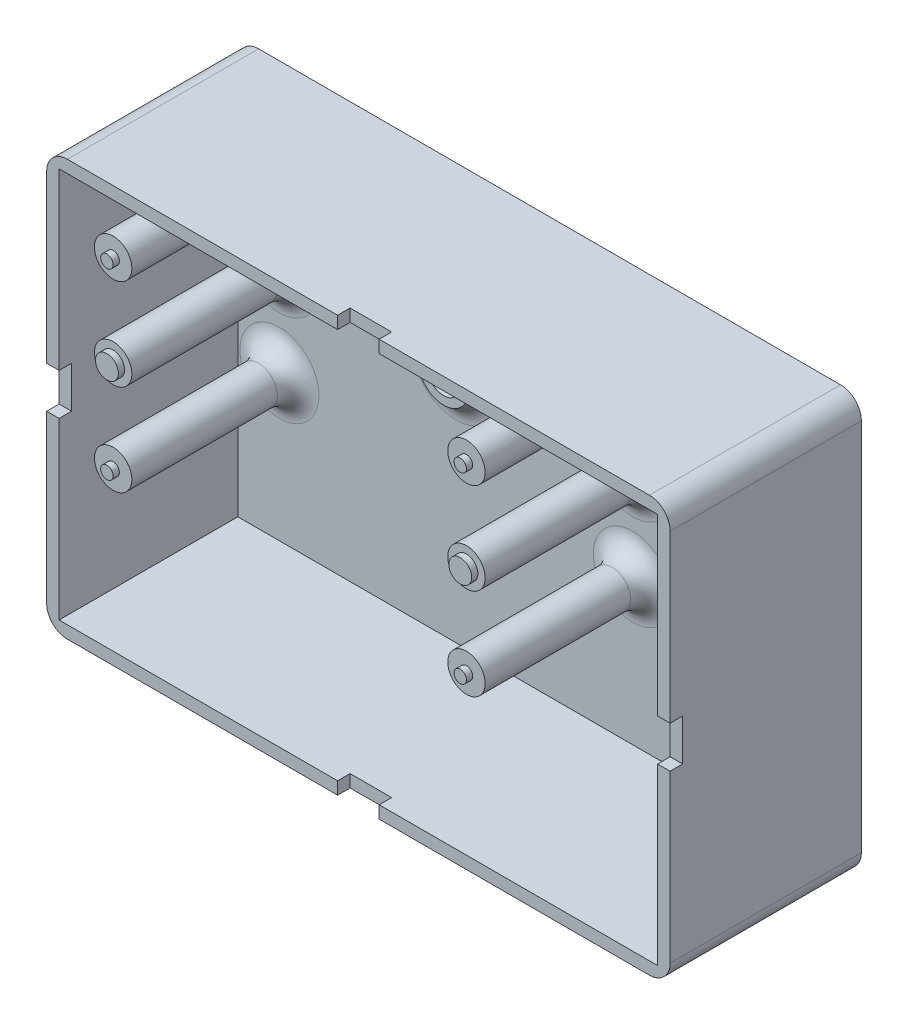
from build123d import *

# Parameters (mm, degrees)
SKETCH_1_W          = 150
SKETCH_1_H          = 100
EXTRUDE_1_DEPTH     = 46
SKETCH_3_W          = 144
SKETCH_3_H          = 94
CUT_EXTRUDE_2_DEPTH = 43
SKETCH_5_R          = 4.5
EXTRUDE_3_DEPTH     = 40
SKETCH_6_R          = 6
SKETCH_6_R_2        = 4
EXTRUDE_4_DEPTH     = 3
SKETCH_7_R          = 1.5
SKETCH_7_R_2        = 2.75
EXTRUDE_5_DEPTH     = 1.5
SKETCH_9_W          = 10
SKETCH_9_H          = 6
SKETCH_9_W_2        = 6
SKETCH_9_H_2        = 10
CUT_EXTRUDE_3_DEPTH = 3
FILLET_1_R          = 5


with BuildPart() as part:
    # 草图1 → 凸台-拉伸1 (new body)
    with BuildSketch(Plane.XY):
        Rectangle(SKETCH_1_W, SKETCH_1_H)
    extrude(amount=EXTRUDE_1_DEPTH)

    # 草图3 → 切除-拉伸2 (cut)
    with BuildSketch(Plane.XY.offset(46)):
        Rectangle(SKETCH_3_W, SKETCH_3_H)
    extrude(amount=-CUT_EXTRUDE_2_DEPTH, mode=Mode.SUBTRACT)

    # 草图5 → 凸台-拉伸3 (add)
    with BuildSketch(Plane.XY.offset(3)):
        with Locations((-62, 32)):
            Circle(SKETCH_5_R)
        with Locations((23, 32)):
            Circle(SKETCH_5_R)
        with Locations((-62, -12)):
            Circle(SKETCH_5_R)
        with Locations((23, -12)):
            Circle(SKETCH_5_R)
        with Locations((23, 10)):
            Circle(SKETCH_5_R)
        with Locations((-62, 10)):
            Circle(SKETCH_5_R)
    extrude(amount=EXTRUDE_3_DEPTH)

    # 草图6 → 凸台-拉伸4 (add)
    with BuildSketch(Plane.XY.offset(3)):
        with Locations((-19.5, 10)):
            Circle(SKETCH_6_R)
        with Locations((-19.5, 10)):
            Circle(SKETCH_6_R_2, mode=Mode.SUBTRACT)
    extrude(amount=EXTRUDE_4_DEPTH)

    # 草图7 → 凸台-拉伸5 (add)
    with BuildSketch(Plane.XY.offset(43)):
        with Locations((-62, 32)):
            Circle(SKETCH_7_R)
        with Locations((23, 32)):
            Circle(SKETCH_7_R)
        with Locations((-62, 10)):
            Circle(SKETCH_7_R_2)
        with Locations((23, 10)):
            Circle(SKETCH_7_R_2)
        with Locations((23, -12)):
            Circle(SKETCH_7_R)
        with Locations((-62, -12)):
            Circle(SKETCH_7_R)
    extrude(amount=EXTRUDE_5_DEPTH)

    # 草图9 → 切除-拉伸3 (cut)
    with BuildSketch(Plane.XY.offset(46)):
        with Locations((0, 47)):
            Rectangle(SKETCH_9_W, SKETCH_9_H)
        with Locations((0, -50)):
            Rectangle(SKETCH_9_W, SKETCH_9_H)
        with Locations((72, 0)):
            Rectangle(SKETCH_9_W_2, SKETCH_9_H_2)
        with Locations((-72, 0)):
            Rectangle(SKETCH_9_W_2, SKETCH_9_H_2)
    extrude(amount=-CUT_EXTRUDE_3_DEPTH, mode=Mode.SUBTRACT)

    # 圆角1
    # the kernel refuses this fillet: 5 mm, written as the material it adds along each edge
    with BuildSketch(Plane(origin=(-62, 32, 3), x_dir=(1, 0, 0), z_dir=(0, -1, 0))) as fillet_1_piece_1:
        with BuildLine():
            CenterArc((4.5 + FILLET_1_R, FILLET_1_R), FILLET_1_R, 180, 90)
            Line((4.5, FILLET_1_R), (4.5, 0))
            Line((4.5, 0), (4.5 + FILLET_1_R, 0))
        make_face()
    revolve(axis=Axis((-62, 32, 3), (0, 0, 1)))
    with BuildSketch(Plane(origin=(23, 32, 3), x_dir=(1, 0, 0), z_dir=(0, -1, 0))) as fillet_1_piece_2:
        with BuildLine():
            CenterArc((4.5 + FILLET_1_R, FILLET_1_R), FILLET_1_R, 180, 90)
            Line((4.5, FILLET_1_R), (4.5, 0))
            Line((4.5, 0), (4.5 + FILLET_1_R, 0))
        make_face()
    revolve(axis=Axis((23, 32, 3), (0, 0, 1)))
    with BuildSketch(Plane(origin=(-62, -12, 3), x_dir=(1, 0, 0), z_dir=(0, -1, 0))) as fillet_1_piece_3:
        with BuildLine():
            CenterArc((4.5 + FILLET_1_R, FILLET_1_R), FILLET_1_R, 180, 90)
            Line((4.5, FILLET_1_R), (4.5, 0))
            Line((4.5, 0), (4.5 + FILLET_1_R, 0))
        make_face()
    revolve(axis=Axis((-62, -12, 3), (0, 0, 1)))
    with BuildSketch(Plane(origin=(23, -12, 3), x_dir=(1, 0, 0), z_dir=(0, -1, 0))) as fillet_1_piece_4:
        with BuildLine():
            CenterArc((4.5 + FILLET_1_R, FILLET_1_R), FILLET_1_R, 180, 90)
            Line((4.5, FILLET_1_R), (4.5, 0))
            Line((4.5, 0), (4.5 + FILLET_1_R, 0))
        make_face()
    revolve(axis=Axis((23, -12, 3), (0, 0, 1)))
    with BuildSketch(Plane(origin=(23, 10, 3), x_dir=(1, 0, 0), z_dir=(0, -1, 0))) as fillet_1_piece_5:
        with BuildLine():
            CenterArc((4.5 + FILLET_1_R, FILLET_1_R), FILLET_1_R, 180, 90)
            Line((4.5, FILLET_1_R), (4.5, 0))
            Line((4.5, 0), (4.5 + FILLET_1_R, 0))
        make_face()
    revolve(axis=Axis((23, 10, 3), (0, 0, 1)))
    with BuildSketch(Plane(origin=(-62, 10, 3), x_dir=(1, 0, 0), z_dir=(0, -1, 0))) as fillet_1_piece_6:
        with BuildLine():
            CenterArc((4.5 + FILLET_1_R, FILLET_1_R), FILLET_1_R, 180, 90)
            Line((4.5, FILLET_1_R), (4.5, 0))
            Line((4.5, 0), (4.5 + FILLET_1_R, 0))
        make_face()
    revolve(axis=Axis((-62, 10, 3), (0, 0, 1)))
    with BuildSketch(Plane(origin=(-19.5, 10, 3), x_dir=(1, 0, 0), z_dir=(0, -1, 0))) as fillet_1_piece_7:
        with BuildLine():
            CenterArc((10.582575695, 5), FILLET_1_R, 203.578178478, 66.421821522)
            Line((6, 3), (6, 0))
            Line((6, 0), (10.582575695, 0))
        make_face()
    revolve(axis=Axis((-19.5, 10, 3), (0, 0, 1)))
    # the kernel refuses this fillet: 5 mm, written as the material it takes off along each edge
    with BuildSketch(Plane(origin=(-75, -50, -12.5), x_dir=(1, 0, 0), z_dir=(0, 0, 1)), Plane(origin=(-75, 50, -12.5), x_dir=(0, -1, 0), z_dir=(0, 0, 1))) as fillet_1_2_piece_1:
        with BuildLine():
            CenterArc((FILLET_1_R, FILLET_1_R), FILLET_1_R, 180, 90)
            Line((0, FILLET_1_R), (0, 0))
            Line((0, 0), (FILLET_1_R, 0))
        make_face()
    extrude(amount=71, mode=Mode.SUBTRACT)
    with BuildSketch(Plane(origin=(75, -50, -12.5), x_dir=(-1, 0, 0), z_dir=(0, 0, 1)), Plane(origin=(75, 50, -12.5), x_dir=(0, -1, 0), z_dir=(0, 0, 1))) as fillet_1_2_piece_2:
        with BuildLine():
            CenterArc((FILLET_1_R, -FILLET_1_R), FILLET_1_R, 90, 90)
            Line((0, -FILLET_1_R), (0, 0))
            Line((0, 0), (FILLET_1_R, 0))
        make_face()
    extrude(amount=71, mode=Mode.SUBTRACT)


solid = part.part
